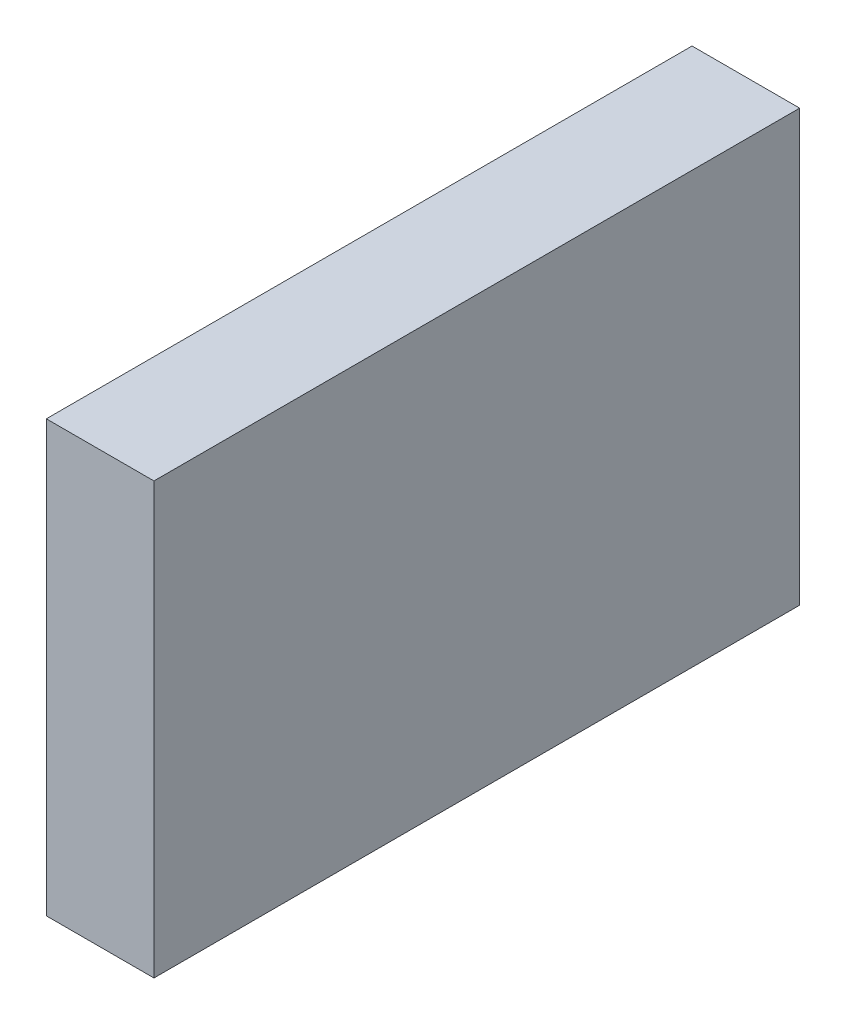
from build123d import *

# Parameters (mm, degrees)
BOSS_EXTRUDE1_DEPTH = 38.1
SKETCH2_R           = 11.049
CUT_EXTRUDE1_DEPTH  = 6.35
SKETCH2_4_R         = 3.556
CUT_EXTRUDE2_DEPTH  = 6.35
SKETCH4_W           = 111.346479962
SKETCH4_H           = 83.31624037
CUT_EXTRUDE3_DEPTH  = 76.2


with BuildPart() as part:
    # Sketch1 → Boss-Extrude1 (new body)
    with BuildSketch(Plane.XY):
        Polygon((0, 76.2), (0, 0), (6.35, 0), (6.35, 69.85), (94.447991824, 69.85), (94.447991824, 101.6), (88.097991824, 101.6), (88.097991824, 76.2), align=None)
    extrude(amount=BOSS_EXTRUDE1_DEPTH)

    # Sketch2 → Cut-Extrude1 (cut)
    with BuildSketch(Plane.ZY):
        with Locations((19.05, 20.32)):
            Circle(SKETCH2_R)
    extrude(amount=-CUT_EXTRUDE1_DEPTH, mode=Mode.SUBTRACT)

    # Sketch2<4> → Cut-Extrude2 (cut)
    with BuildSketch(Plane.ZY):
        with Locations((19.05, 42.672)):
            Circle(SKETCH2_4_R)
    extrude(amount=-CUT_EXTRUDE2_DEPTH, mode=Mode.SUBTRACT)

    # Sketch4 → Cut-Extrude3 (cut)
    with BuildSketch(Plane.XY.offset(38.1)):
        with Locations((55.673239981, 34.541879815)):
            Rectangle(SKETCH4_W, SKETCH4_H)
    extrude(amount=-CUT_EXTRUDE3_DEPTH, mode=Mode.SUBTRACT)


solid = part.part
